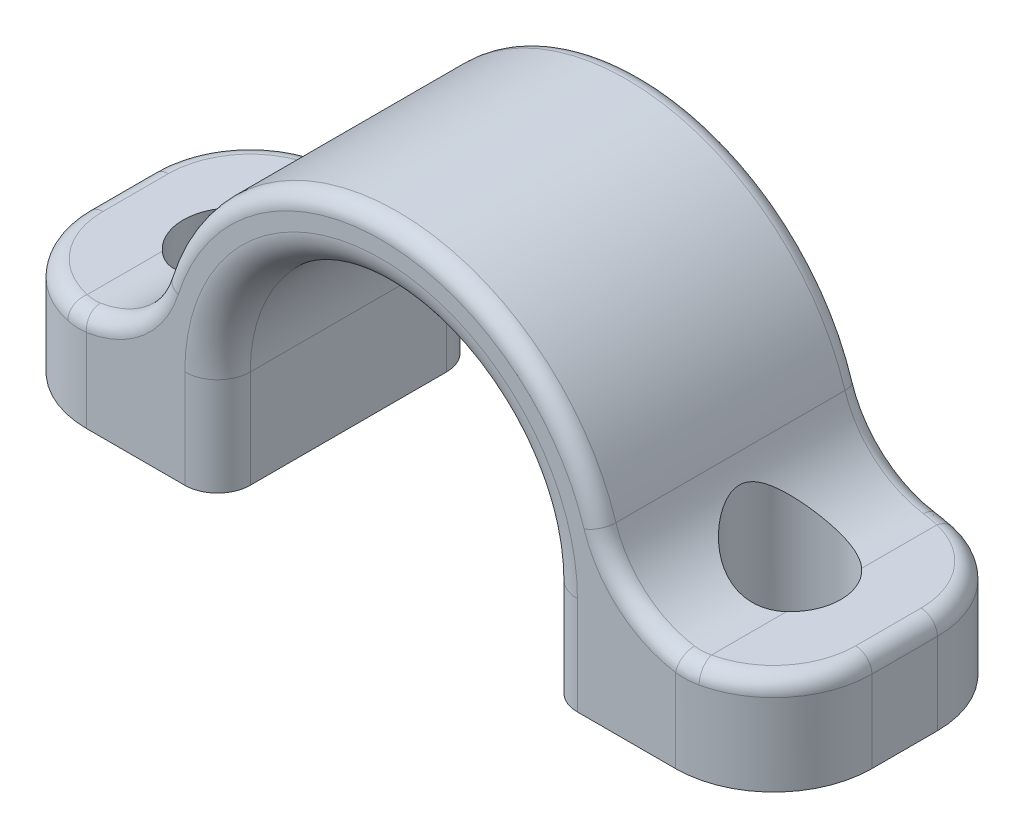
from build123d import *

# Parameters (mm, degrees)
BOSS_EXTRUDE1_DEPTH = 8
SKETCH2_R           = 1.55
CUT_EXTRUDE1_DEPTH  = 18.549928775
FILLET1_R           = 3
FILLET2_R           = 3
FILLET3_R           = 1
FILLET4_R           = 0.5


with BuildPart() as part:
    # Sketch1 → Boss-Extrude1 (new body)
    with BuildSketch(Plane.XY):
        with BuildLine():
            Line((-5, -1.5), (-5, 0))
            Line((-5, 0), (-5, 1.5))
            ThreePointArc((-5, 1.5), (0, 6.5), (5, 1.5))
            Line((5, 1.5), (5, 0))
            Line((5, 0), (5, -1.5))
            Line((5, -1.5), (12, -1.5))
            Line((12, -1.5), (12, 1.5))
            Line((12, 1.5), (7, 1.5))
            ThreePointArc((7, 1.5), (0, 8.5), (-7, 1.5))
            Line((-7, 1.5), (-12, 1.5))
            Line((-12, 1.5), (-12, -1.5))
            Line((-12, -1.5), (-5, -1.5))
        make_face()
    extrude(amount=BOSS_EXTRUDE1_DEPTH)

    # Sketch2 → Cut-Extrude1 (cut, through all)
    with BuildSketch(Plane.XZ.offset(1.5)):
        with Locations(Location((-8.5, 4, 0), (0, 0, 270))):
            Circle(SKETCH2_R)
        with Locations(Location((8.5, 4, 0), (0, 0, 270))):
            Circle(SKETCH2_R)
    extrude(amount=-CUT_EXTRUDE1_DEPTH, mode=Mode.SUBTRACT)

    # Fillet1
    # the kernel refuses this fillet: 3 mm, written as the material it adds along each edge
    with BuildSketch(Plane(origin=(-7, 1.5, -1.957967552), x_dir=(-1, 0, 0), z_dir=(0, 0, 1))) as fillet1_piece_1_section:
        with BuildLine():
            CenterArc((2.539392014, -3), FILLET1_R, 90, 72.542396876)
            ThreePointArc((-0.32242559, -2.1), (-0.081075919, -1.062303895), (0, 0))
            Line((0, 0), (2.539392014, 0))
        make_face()
    fillet1_piece_1 = extrude(amount=9.957967552, mode=Mode.PRIVATE)
    fillet1_piece_1 = split(fillet1_piece_1, bisect_by=Plane(origin=(-8.907059095, 1.548017233, 0), z_dir=(0, 0, 1)), keep=Keep.TOP, mode=Mode.PRIVATE)
    fillet1_piece_1 = fillet1_piece_1 - Plane(origin=(-8.5, 1.548017233, 4), x_dir=(0, 0, -1), z_dir=(0, -1, 0)) * Cylinder(1.55, 31, mode=Mode.PRIVATE)
    add(fillet1_piece_1)
    with BuildSketch(Plane(origin=(-7, 1.5, 0), x_dir=(-1, 0, 0), z_dir=(0, 0, 1))) as fillet1_piece_2_section:
        with BuildLine():
            CenterArc((2.539392014, -3), FILLET1_R, 90, 72.542396876)
            ThreePointArc((-0.32242559, -2.1), (-0.081075919, -1.062303895), (0, 0))
            Line((0, 0), (2.539392014, 0))
        make_face()
    fillet1_piece_2 = extrude(amount=9.957967552, mode=Mode.PRIVATE)
    fillet1_piece_2 = split(fillet1_piece_2, bisect_by=Plane(origin=(-8.907059095, 1.548017233, 8), z_dir=(0, 0, -1)), keep=Keep.TOP, mode=Mode.PRIVATE)
    fillet1_piece_2 = fillet1_piece_2 - Plane(origin=(-8.5, 1.548017233, 4), x_dir=(0, 0, -1), z_dir=(0, -1, 0)) * Cylinder(1.55, 31, mode=Mode.PRIVATE)
    add(fillet1_piece_2)
    with BuildSketch(Plane(origin=(7, 1.5, -1.957967552), x_dir=(-0.15175769928250127, 0.9884177258166114, 0), z_dir=(0, 0, 1))) as fillet1_piece_3_section:
        with BuildLine():
            CenterArc((2.579880888, -2.965253177), FILLET1_R, 98.728801562, 72.542396876)
            Line((-0.38537229, -2.50998008), (0, 0))
            ThreePointArc((0, 0), (1.062303895, -0.081075919), (2.12460779, 0))
        make_face()
    fillet1_piece_3 = extrude(amount=9.957967552, mode=Mode.PRIVATE)
    fillet1_piece_3 = split(fillet1_piece_3, bisect_by=Plane(origin=(6.913079809, 3.011198011, 0), z_dir=(0, 0, 1)), keep=Keep.TOP, mode=Mode.PRIVATE)
    fillet1_piece_3 = fillet1_piece_3 - Plane(origin=(8.5, 3.011198011, 4), x_dir=(0, 0, -1), z_dir=(0, -1, 0)) * Cylinder(1.55, 30, mode=Mode.PRIVATE)
    add(fillet1_piece_3)
    with BuildSketch(Plane(origin=(7, 1.5, 0), x_dir=(-0.15175769928250127, 0.9884177258166114, 0), z_dir=(0, 0, 1))) as fillet1_piece_4_section:
        with BuildLine():
            CenterArc((2.579880888, -2.965253177), FILLET1_R, 98.728801562, 72.542396876)
            Line((-0.38537229, -2.50998008), (0, 0))
            ThreePointArc((0, 0), (1.062303895, -0.081075919), (2.12460779, 0))
        make_face()
    fillet1_piece_4 = extrude(amount=9.957967552, mode=Mode.PRIVATE)
    fillet1_piece_4 = split(fillet1_piece_4, bisect_by=Plane(origin=(6.913079809, 3.011198011, 8), z_dir=(0, 0, -1)), keep=Keep.TOP, mode=Mode.PRIVATE)
    fillet1_piece_4 = fillet1_piece_4 - Plane(origin=(8.5, 3.011198011, 4), x_dir=(0, 0, -1), z_dir=(0, -1, 0)) * Cylinder(1.55, 30, mode=Mode.PRIVATE)
    add(fillet1_piece_4)

    # Fillet2
    # the kernel refuses this fillet: 3 mm, written as the material it takes off along each edge
    with BuildSketch(Plane(origin=(-12, 9, 0), x_dir=(1, 0, 0), z_dir=(0, -1, 0)), Plane(origin=(12, -9, 0), x_dir=(-1, 0, 0), z_dir=(0, 1, 0))) as fillet2_piece_1:
        with BuildLine():
            CenterArc((FILLET2_R, FILLET2_R), FILLET2_R, 180, 90)
            Line((0, FILLET2_R), (0, 0))
            Line((0, 0), (FILLET2_R, 0))
        make_face()
    extrude(amount=18, mode=Mode.SUBTRACT)
    with BuildSketch(Plane(origin=(-12, 9, 8), x_dir=(1, 0, 0), z_dir=(0, -1, 0)), Plane(origin=(12, -9, 8), x_dir=(-1, 0, 0), z_dir=(0, 1, 0))) as fillet2_piece_2:
        with BuildLine():
            CenterArc((FILLET2_R, -FILLET2_R), FILLET2_R, 90, 90)
            Line((0, -FILLET2_R), (0, 0))
            Line((0, 0), (FILLET2_R, 0))
        make_face()
    extrude(amount=18, mode=Mode.SUBTRACT)

    # Fillet3
    fillet3_edges = [part.edges().sort_by_distance(p)[0] for p in [
        (5, 0, 0),
        (0, 6.5, 0),
        (-5, 0, 0),
        (-5, 0, 8),
        (0, 6.5, 8),
        (5, 0, 8),
    ]]
    fillet(fillet3_edges, radius=FILLET3_R)

    # Fillet4
    fillet4_edges = [part.edges().sort_by_distance(p)[0] for p in [
        (0, 8.5, 8),
        (0, 8.5, 0),
        (-7.553486472, 2.251405066, 8),
        (7.553486472, 2.251405066, 0),
        (7.553486472, 2.251405066, 8),
        (-12, 1.5, 4),
        (-11.304145833, 1.5, 1.078825365),
        (-11.304145833, 1.5, 6.921174635),
        (-7.553486472, 2.251405066, 0),
        (-9.269696007, 1.512147249, 0.012147249),
        (-9.269696007, 1.512147249, 7.987852751),
        (12, 1.5, 4),
        (9.269696008, 1.512147249, 0.012147249),
        (9.269696008, 1.512147249, 7.987852751),
        (11.304145833, 1.5, 1.078825365),
        (11.304145833, 1.5, 6.921174635),
    ]]
    fillet(fillet4_edges, radius=FILLET4_R)


solid = part.part
